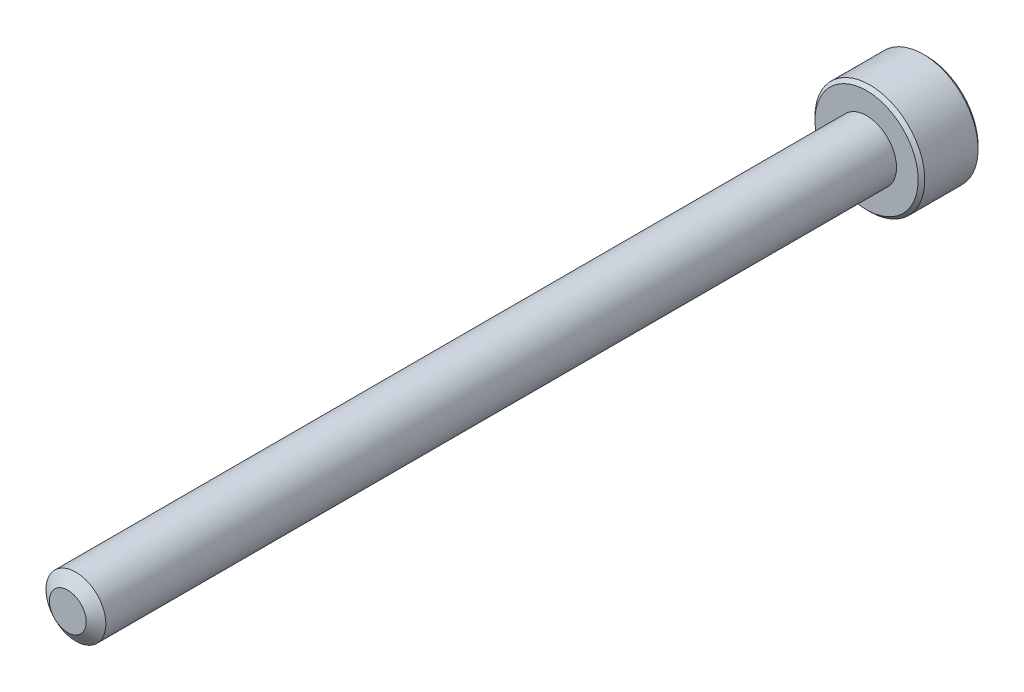
from build123d import *

# Parameters (mm, degrees)
SKETCH1_R          = 1.5
EXTRUDE1_DEPTH     = 40
SKETCH6_R          = 2.75
EXTRUDE2_DEPTH     = 3
CUT_EXTRUDE1_DEPTH = 1.875
CHAMFER1_SIZE      = 0.165


with BuildPart() as part:
    # Sketch1 → Extrude1 (new body)
    with BuildSketch(Plane.XY):
        Circle(SKETCH1_R)
    extrude(amount=-EXTRUDE1_DEPTH)

    # Sketch4 → Cut-Revolve1 (revolve, cut)
    with BuildSketch(Plane(origin=(0, 0, 0), x_dir=(0, 0, -1), z_dir=(1, 0, 0))):
        Polygon((0.405251783, 1.5), (0, 0.921240474), (0, 1.5), align=None)
    revolve(axis=Axis((0, 0, 0), (0, 0, -1)), mode=Mode.SUBTRACT)

    # Sketch6 → Extrude2 (add)
    with BuildSketch(Plane(origin=(0, 0, -40), x_dir=(-1, 0, 0), z_dir=(0, 0, -1))):
        Circle(SKETCH6_R)
    extrude(amount=EXTRUDE2_DEPTH)

    # Sketch7 → Cut-Extrude1 (cut)
    with BuildSketch(Plane(origin=(0, 0, -43), x_dir=(-1, 0, 0), z_dir=(0, 0, -1))):
        Polygon((0, 1.443375673), (-1.25, 0.721687836), (-1.25, -0.721687836), (0, -1.443375673), (1.25, -0.721687836), (1.25, 0.721687836), align=None)
    extrude(amount=-CUT_EXTRUDE1_DEPTH, mode=Mode.SUBTRACT)

    # Cut-Extrude2 cone 1 section (through the dimple's axis) → Cut-Extrude2 (revolve, cut)
    with BuildSketch(Plane(origin=(0, 0, -43), x_dir=(0, 1, 0), z_dir=(1, 0, 0))):
        Polygon((0, 0), (1.443375673, 0), (0, 1.443375673), align=None)
    revolve(axis=Axis((0, 0, -43), (0, 0, 1)), mode=Mode.SUBTRACT)

    # Chamfer1
    chamfer1_edges = [part.edges().sort_by_distance(p)[0] for p in [
        (2.75, 0, -43),
        (2.75, 0, -40),
    ]]
    chamfer(chamfer1_edges, length=CHAMFER1_SIZE)

    # Sketch10 → Revolve1 (revolve)
    with BuildSketch(Plane(origin=(0, 0, 0), x_dir=(0, 0, -1), z_dir=(1, 0, 0))):
        Polygon((40, 1.5), (40, 0), (39.253679656, 0), (39.875, 1.5), align=None)
    revolve(axis=Axis((0, 0, -40), (0, 0, 1)))


solid = part.part
